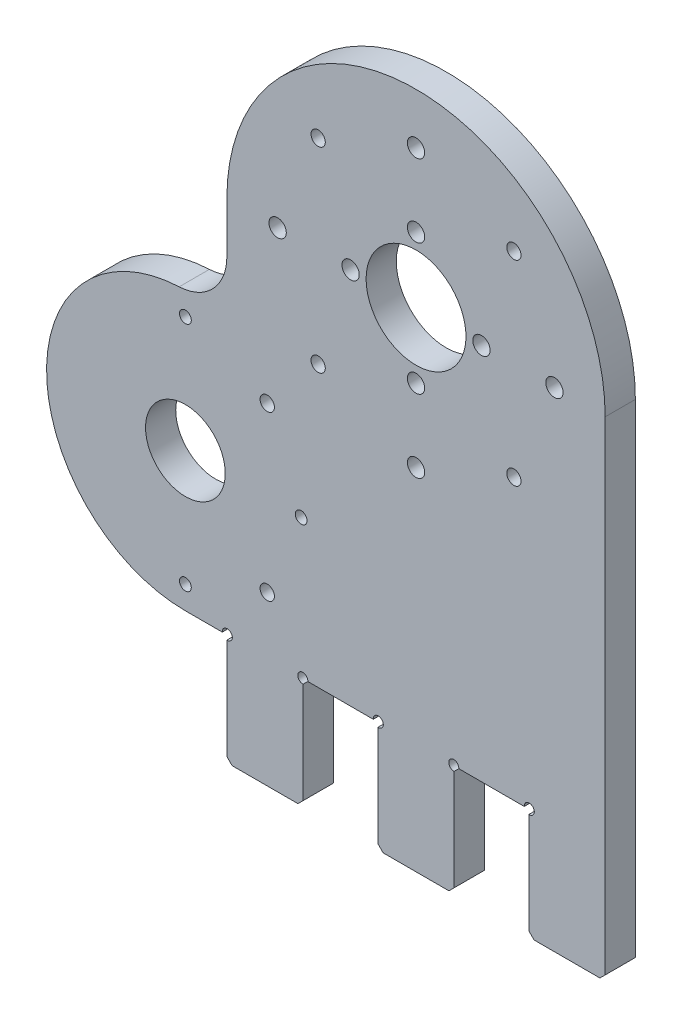
from build123d import *

# Parameters (mm, degrees)
SKETCH1_R               = 8
SKETCH1_R_2             = 10
SKETCH1_R_3             = 1.25
SKETCH1_R_4             = 1.5
SKETCH1_R_5             = 1.8
BOSS_EXTRUDE1_DEPTH     = 6
FILLET1_R               = 10
SKETCH2_W               = 15
SKETCH2_H               = 22
BOSS_EXTRUDE2_DEPTH     = 6
SKETCH3_R               = 1
CUT_EXTRUDE1_DEPTH      = 159.031622895
CHAMFER1_SIZE           = 1
MOVE_FACE1_OUTLINE_R    = 8
MOVE_FACE1_OUTLINE_R_2  = 7.92
MOVE_FACE1_OUTLINE_R_3  = 10
MOVE_FACE1_OUTLINE_R_4  = 9.92
MOVE_FACE1_OUTLINE_R_5  = 1.25
MOVE_FACE1_OUTLINE_R_6  = 1.17
MOVE_FACE1_OUTLINE_R_7  = 1.5
MOVE_FACE1_OUTLINE_R_8  = 1.42
MOVE_FACE1_OUTLINE_R_9  = 1.8
MOVE_FACE1_OUTLINE_R_10 = 1.72
MOVE_FACE1_DEPTH        = 6


# Read off the part's stored shape, not the designer's step: Move Face1
with BuildPart() as part:
    # Sketch1 → Boss-Extrude1 (new body)
    with BuildSketch(Plane.XY):
        with BuildLine():
            Line((-40.498784978, 0), (0, 0))
            Line((0, 0), (0, 75))
            ThreePointArc((0, 75), (-37.5, 112.5), (-75, 75))
            Line((-75, 75), (-75, 55))
            Line((-75, 55), (-83.323029145, 55))
            ThreePointArc((-83.323029145, 55), (-110.823029145, 27.5), (-83.323029145, 0))
            Line((-83.323029145, 0), (-40.498784978, 0))
        make_face()
        with Locations((-83.323029145, 27.5)):
            Circle(SKETCH1_R, mode=Mode.SUBTRACT)
        with Locations((-37.5, 75)):
            Circle(SKETCH1_R_2, mode=Mode.SUBTRACT)
        with Locations((-83.323029145, 50.5)):
            Circle(SKETCH1_R_3, mode=Mode.SUBTRACT)
        with Locations((-67.059573177, 43.763455967)):
            Circle(SKETCH1_R_4, mode=Mode.SUBTRACT)
        with Locations((-60.323029145, 27.5)):
            Circle(SKETCH1_R_3, mode=Mode.SUBTRACT)
        with Locations((-67.059573177, 11.236544033)):
            Circle(SKETCH1_R_4, mode=Mode.SUBTRACT)
        with Locations((-83.323029145, 4.5)):
            Circle(SKETCH1_R_3, mode=Mode.SUBTRACT)
        with Locations((-37.5, 102.5)):
            Circle(SKETCH1_R_5, mode=Mode.SUBTRACT)
        with Locations((-65, 75)):
            Circle(SKETCH1_R_5, mode=Mode.SUBTRACT)
        with Locations((-10, 75)):
            Circle(SKETCH1_R_5, mode=Mode.SUBTRACT)
        with Locations((-37.5, 47.5)):
            Circle(SKETCH1_R_5, mode=Mode.SUBTRACT)
        with Locations((-56.945436483, 94.445436483)):
            Circle(SKETCH1_R_4, mode=Mode.SUBTRACT)
        with Locations((-18.054563517, 94.445436483)):
            Circle(SKETCH1_R_4, mode=Mode.SUBTRACT)
        with Locations((-18.054563517, 55.554563517)):
            Circle(SKETCH1_R_4, mode=Mode.SUBTRACT)
        with Locations((-56.945436483, 55.554563517)):
            Circle(SKETCH1_R_4, mode=Mode.SUBTRACT)
        with Locations((-37.5, 88)):
            Circle(SKETCH1_R_5, mode=Mode.SUBTRACT)
        with Locations((-24.5, 75)):
            Circle(SKETCH1_R_5, mode=Mode.SUBTRACT)
        with Locations((-37.5, 62)):
            Circle(SKETCH1_R_5, mode=Mode.SUBTRACT)
        with Locations((-50.5, 75)):
            Circle(SKETCH1_R_5, mode=Mode.SUBTRACT)
    extrude(amount=BOSS_EXTRUDE1_DEPTH)

    # Fillet1
    fillet1_edges = [part.edges().sort_by_distance(p)[0] for p in [
        (-75, 55, 3),
    ]]
    fillet(fillet1_edges, radius=FILLET1_R)

    # Sketch2 → Boss-Extrude2 (add)
    with BuildSketch(Plane(origin=(0, 0, 0), x_dir=(-1, 0, 0), z_dir=(0, 0, -1))):
        with Locations((7.5, -11)):
            Rectangle(SKETCH2_W, SKETCH2_H)
        with Locations((37.5, -11)):
            Rectangle(SKETCH2_W, SKETCH2_H)
        with Locations((67.5, -11)):
            Rectangle(SKETCH2_W, SKETCH2_H)
    extrude(amount=-BOSS_EXTRUDE2_DEPTH)

    # Sketch3 → Cut-Extrude1 (cut, through all)
    with BuildSketch(Plane.XY.offset(6)):
        with Locations((-75, 0)):
            Circle(SKETCH3_R)
        with Locations((-60, 0)):
            Circle(SKETCH3_R)
        with Locations((-45, 0)):
            Circle(SKETCH3_R)
        with Locations((-30, 0)):
            Circle(SKETCH3_R)
        with Locations((-15, 0)):
            Circle(SKETCH3_R)
    extrude(amount=-CUT_EXTRUDE1_DEPTH, mode=Mode.SUBTRACT)

    # Chamfer1
    chamfer1_edges = [part.edges().sort_by_distance(p)[0] for p in [
        (0, -22, 3),
        (-15, -22, 3),
        (-30, -22, 3),
        (-45, -22, 3),
        (-60, -22, 3),
        (-75, -22, 3),
    ]]
    chamfer(chamfer1_edges, length=CHAMFER1_SIZE)

    # Move Face1 outline → Move Face1 (add)
    # profile 1 of 24: a face of its own
    with BuildSketch(Plane.XY):
        with BuildLine():
            Line((-59.003205136, -0.08), (-45.996794864, -0.08))
            ThreePointArc((-45.996794864, -0.08), (-45.999198395, -0.04003209), (-46, 0))
            Line((-46, 0), (-59, 0))
            ThreePointArc((-59, 0), (-59.000801605, -0.04003209), (-59.003205136, -0.08))
        make_face()
    # profile 2 of 24: a face of its own
    with BuildSketch(Plane.XY):
        with BuildLine():
            Line((-45, -21), (-45, -1))
            ThreePointArc((-45, -1), (-45.04003209, -0.999198395), (-45.08, -0.996794864))
            Line((-45.08, -0.996794864), (-45.08, -21.033137085))
            Line((-45.08, -21.033137085), (-44.033137085, -22.08))
            Line((-44.033137085, -22.08), (-30.966862915, -22.08))
            Line((-30.966862915, -22.08), (-29.92, -21.033137085))
            Line((-29.92, -21.033137085), (-29.92, -0.996794864))
            ThreePointArc((-29.92, -0.996794864), (-29.95996791, -0.999198395), (-30, -1))
            Line((-30, -1), (-30, -21))
            Line((-30, -21), (-31, -22))
            Line((-31, -22), (-44, -22))
            Line((-44, -22), (-45, -21))
        make_face()
    # profile 3 of 24: a face of its own
    with BuildSketch(Plane.XY):
        with BuildLine():
            ThreePointArc((-59.92, -0.996794864), (-59.95996791, -0.999198395), (-60, -1))
            Line((-60, -1), (-60, -21))
            Line((-60, -21), (-61, -22))
            Line((-61, -22), (-74, -22))
            Line((-74, -22), (-75, -21))
            Line((-75, -21), (-75, -1))
            ThreePointArc((-75, -1), (-75.04003209, -0.999198395), (-75.08, -0.996794864))
            Line((-75.08, -0.996794864), (-75.08, -21.033137085))
            Line((-75.08, -21.033137085), (-74.033137085, -22.08))
            Line((-74.033137085, -22.08), (-60.966862915, -22.08))
            Line((-60.966862915, -22.08), (-59.92, -21.033137085))
            Line((-59.92, -21.033137085), (-59.92, -0.996794864))
        make_face()
    # profile 4 of 24: a face of its own
    with BuildSketch(Plane.XY):
        with BuildLine():
            Line((-16, 0), (-29, 0))
            ThreePointArc((-29, 0), (-29.000801605, -0.04003209), (-29.003205136, -0.08))
            Line((-29.003205136, -0.08), (-15.996794864, -0.08))
            ThreePointArc((-15.996794864, -0.08), (-15.999198395, -0.04003209), (-16, 0))
        make_face()
    # profile 5 of 24: a face of its own
    with BuildSketch(Plane.XY):
        with BuildLine():
            ThreePointArc((-75.996794864, -0.08), (-75.999198395, -0.04003209), (-76, 0))
            Line((-76, 0), (-83.323029145, 0))
            ThreePointArc((-83.323029145, 0), (-110.816150501, 26.884956844), (-84.552807772, 54.972488867))
            ThreePointArc((-84.552807772, 54.972488867), (-77.772555006, 58.051331596), (-75, 64.962484818))
            Line((-75, 64.962484818), (-75, 75))
            ThreePointArc((-75, 75), (-37.5, 112.5), (0, 75))
            Line((0, 75), (0, -21))
            Line((0, -21), (-1, -22))
            Line((-1, -22), (-14, -22))
            Line((-14, -22), (-15, -21))
            Line((-15, -21), (-15, -1))
            ThreePointArc((-15, -1), (-15.04003209, -0.999198395), (-15.08, -0.996794864))
            Line((-15.08, -0.996794864), (-15.08, -21.033137085))
            Line((-15.08, -21.033137085), (-14.033137085, -22.08))
            Line((-14.033137085, -22.08), (-0.966862915, -22.08))
            Line((-0.966862915, -22.08), (0.08, -21.033137085))
            Line((0.08, -21.033137085), (0.08, 75))
            ThreePointArc((0.08, 75), (-37.5, 112.58), (-75.08, 75))
            Line((-75.08, 75), (-75.08, 64.962484818))
            ThreePointArc((-75.08, 64.962484818), (-77.830374566, 58.106620822), (-84.55638531, 55.052408834))
            ThreePointArc((-84.55638531, 55.052408834), (-110.896130491, 26.883167628), (-83.323029145, -0.08))
            Line((-83.323029145, -0.08), (-75.996794864, -0.08))
        make_face()
    # profile 6 of 24: a face of its own
    with BuildSketch(Plane.XY):
        with Locations((-83.323029145, 27.5)):
            Circle(MOVE_FACE1_OUTLINE_R)
        with Locations((-83.323029145, 27.5)):
            Circle(MOVE_FACE1_OUTLINE_R_2, mode=Mode.SUBTRACT)
    # profile 7 of 24: a face of its own
    with BuildSketch(Plane.XY):
        with Locations((-37.5, 75)):
            Circle(MOVE_FACE1_OUTLINE_R_3)
        with Locations((-37.5, 75)):
            Circle(MOVE_FACE1_OUTLINE_R_4, mode=Mode.SUBTRACT)
    # profile 8 of 24: a face of its own
    with BuildSketch(Plane.XY):
        with Locations((-83.323029145, 50.5)):
            Circle(MOVE_FACE1_OUTLINE_R_5)
        with Locations((-83.323029145, 50.5)):
            Circle(MOVE_FACE1_OUTLINE_R_6, mode=Mode.SUBTRACT)
    # profile 9 of 24: a face of its own
    with BuildSketch(Plane.XY):
        with Locations((-67.059573177, 43.763455967)):
            Circle(MOVE_FACE1_OUTLINE_R_7)
        with Locations((-67.059573177, 43.763455967)):
            Circle(MOVE_FACE1_OUTLINE_R_8, mode=Mode.SUBTRACT)
    # profile 10 of 24: a face of its own
    with BuildSketch(Plane.XY):
        with Locations((-37.5, 102.5)):
            Circle(MOVE_FACE1_OUTLINE_R_9)
        with Locations((-37.5, 102.5)):
            Circle(MOVE_FACE1_OUTLINE_R_10, mode=Mode.SUBTRACT)
    # profile 11 of 24: a face of its own
    with BuildSketch(Plane.XY):
        with Locations((-60.323029145, 27.5)):
            Circle(MOVE_FACE1_OUTLINE_R_5)
        with Locations((-60.323029145, 27.5)):
            Circle(MOVE_FACE1_OUTLINE_R_6, mode=Mode.SUBTRACT)
    # profile 12 of 24: a face of its own
    with BuildSketch(Plane.XY):
        with Locations((-67.059573177, 11.236544033)):
            Circle(MOVE_FACE1_OUTLINE_R_7)
        with Locations((-67.059573177, 11.236544033)):
            Circle(MOVE_FACE1_OUTLINE_R_8, mode=Mode.SUBTRACT)
    # profile 13 of 24: a face of its own
    with BuildSketch(Plane.XY):
        with Locations((-83.323029145, 4.5)):
            Circle(MOVE_FACE1_OUTLINE_R_5)
        with Locations((-83.323029145, 4.5)):
            Circle(MOVE_FACE1_OUTLINE_R_6, mode=Mode.SUBTRACT)
    # profile 14 of 24: a face of its own
    with BuildSketch(Plane.XY):
        with Locations((-65, 75)):
            Circle(MOVE_FACE1_OUTLINE_R_9)
        with Locations((-65, 75)):
            Circle(MOVE_FACE1_OUTLINE_R_10, mode=Mode.SUBTRACT)
    # profile 15 of 24: a face of its own
    with BuildSketch(Plane.XY):
        with Locations((-10, 75)):
            Circle(MOVE_FACE1_OUTLINE_R_9)
        with Locations((-10, 75)):
            Circle(MOVE_FACE1_OUTLINE_R_10, mode=Mode.SUBTRACT)
    # profile 16 of 24: a face of its own
    with BuildSketch(Plane.XY):
        with Locations((-37.5, 47.5)):
            Circle(MOVE_FACE1_OUTLINE_R_9)
        with Locations((-37.5, 47.5)):
            Circle(MOVE_FACE1_OUTLINE_R_10, mode=Mode.SUBTRACT)
    # profile 17 of 24: a face of its own
    with BuildSketch(Plane.XY):
        with Locations((-56.945436483, 94.445436483)):
            Circle(MOVE_FACE1_OUTLINE_R_7)
        with Locations((-56.945436483, 94.445436483)):
            Circle(MOVE_FACE1_OUTLINE_R_8, mode=Mode.SUBTRACT)
    # profile 18 of 24: a face of its own
    with BuildSketch(Plane.XY):
        with Locations((-37.5, 88)):
            Circle(MOVE_FACE1_OUTLINE_R_9)
        with Locations((-37.5, 88)):
            Circle(MOVE_FACE1_OUTLINE_R_10, mode=Mode.SUBTRACT)
    # profile 19 of 24: a face of its own
    with BuildSketch(Plane.XY):
        with Locations((-18.054563517, 94.445436483)):
            Circle(MOVE_FACE1_OUTLINE_R_7)
        with Locations((-18.054563517, 94.445436483)):
            Circle(MOVE_FACE1_OUTLINE_R_8, mode=Mode.SUBTRACT)
    # profile 20 of 24: a face of its own
    with BuildSketch(Plane.XY):
        with Locations((-18.054563517, 55.554563517)):
            Circle(MOVE_FACE1_OUTLINE_R_7)
        with Locations((-18.054563517, 55.554563517)):
            Circle(MOVE_FACE1_OUTLINE_R_8, mode=Mode.SUBTRACT)
    # profile 21 of 24: a face of its own
    with BuildSketch(Plane.XY):
        with Locations((-56.945436483, 55.554563517)):
            Circle(MOVE_FACE1_OUTLINE_R_7)
        with Locations((-56.945436483, 55.554563517)):
            Circle(MOVE_FACE1_OUTLINE_R_8, mode=Mode.SUBTRACT)
    # profile 22 of 24: a face of its own
    with BuildSketch(Plane.XY):
        with Locations((-24.5, 75)):
            Circle(MOVE_FACE1_OUTLINE_R_9)
        with Locations((-24.5, 75)):
            Circle(MOVE_FACE1_OUTLINE_R_10, mode=Mode.SUBTRACT)
    # profile 23 of 24: a face of its own
    with BuildSketch(Plane.XY):
        with Locations((-37.5, 62)):
            Circle(MOVE_FACE1_OUTLINE_R_9)
        with Locations((-37.5, 62)):
            Circle(MOVE_FACE1_OUTLINE_R_10, mode=Mode.SUBTRACT)
    # profile 24 of 24: a face of its own
    with BuildSketch(Plane.XY):
        with Locations((-50.5, 75)):
            Circle(MOVE_FACE1_OUTLINE_R_9)
        with Locations((-50.5, 75)):
            Circle(MOVE_FACE1_OUTLINE_R_10, mode=Mode.SUBTRACT)
    extrude(amount=MOVE_FACE1_DEPTH)


solid = part.part
